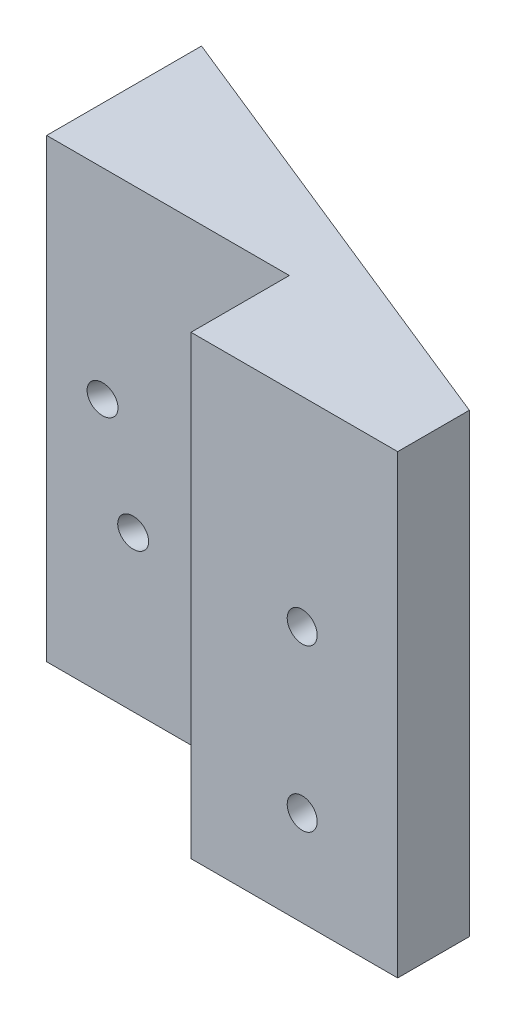
from build123d import *

# Parameters (mm, degrees)
BOSS_EXTRUDE1_DEPTH = 70
SKETCH3_W           = 37.26135862
SKETCH3_H           = 9.1
CUT_EXTRUDE1_DEPTH  = 70
SKETCH4_W           = 31.73864138
SKETCH4_H           = 6
BOSS_EXTRUDE2_DEPTH = 70
SKETCH5_R           = 2.3
CUT_EXTRUDE2_DEPTH  = 20
SKETCH6_R           = 2.2
SKETCH6_R_2         = 2
CUT_EXTRUDE3_DEPTH  = 45


with BuildPart() as part:
    # Sketch1 → Boss-Extrude1 (new body)
    with BuildSketch(Plane(origin=(0, 0, 0), x_dir=(1, 0, 0), z_dir=(0, 1, 0))):
        Polygon((0, 32.877809583), (0, 0), (69, 0), (69, 5), align=None)
    extrude(amount=BOSS_EXTRUDE1_DEPTH)

    # Sketch3 → Cut-Extrude1 (cut)
    with BuildSketch(Plane(origin=(0, 70, 0), x_dir=(1, 0, 0), z_dir=(0, 1, 0))):
        with Locations((18.63067931, 4.55)):
            Rectangle(SKETCH3_W, SKETCH3_H)
    extrude(amount=-CUT_EXTRUDE1_DEPTH, mode=Mode.SUBTRACT)

    # Sketch4 → Boss-Extrude2 (add)
    with BuildSketch(Plane(origin=(0, 70, 0), x_dir=(1, 0, 0), z_dir=(0, 1, 0))):
        with Locations((53.13067931, -3)):
            Rectangle(SKETCH4_W, SKETCH4_H)
    extrude(amount=-BOSS_EXTRUDE2_DEPTH)

    # Sketch5 → Cut-Extrude2 (cut)
    with BuildSketch(Plane.XY.offset(6)):
        with Locations((54.336872709, 39.386266727)):
            Circle(SKETCH5_R)
        with Locations((54.336872709, 14.608663862)):
            Circle(SKETCH5_R)
    extrude(amount=-CUT_EXTRUDE2_DEPTH, mode=Mode.SUBTRACT)

    # Sketch6 → Cut-Extrude3 (cut)
    with BuildSketch(Plane(origin=(11.419422814, 0, -28.264063282), x_dir=(-0.9271838545667899, 0, -0.3746065934159063), z_dir=(0.3746065934159063, 0, -0.9271838545667899))):
        with Locations((-4.544331613, 39.212096207)):
            Circle(SKETCH6_R)
        with Locations((-8.904242573, 23.817578468)):
            Circle(SKETCH6_R)
        with Locations((-19.938849352, 43.572007167)):
            Circle(SKETCH6_R)
        with Locations((-24.298760312, 28.177489427)):
            Circle(SKETCH6_R_2)
    extrude(amount=-CUT_EXTRUDE3_DEPTH, mode=Mode.SUBTRACT)


solid = part.part
